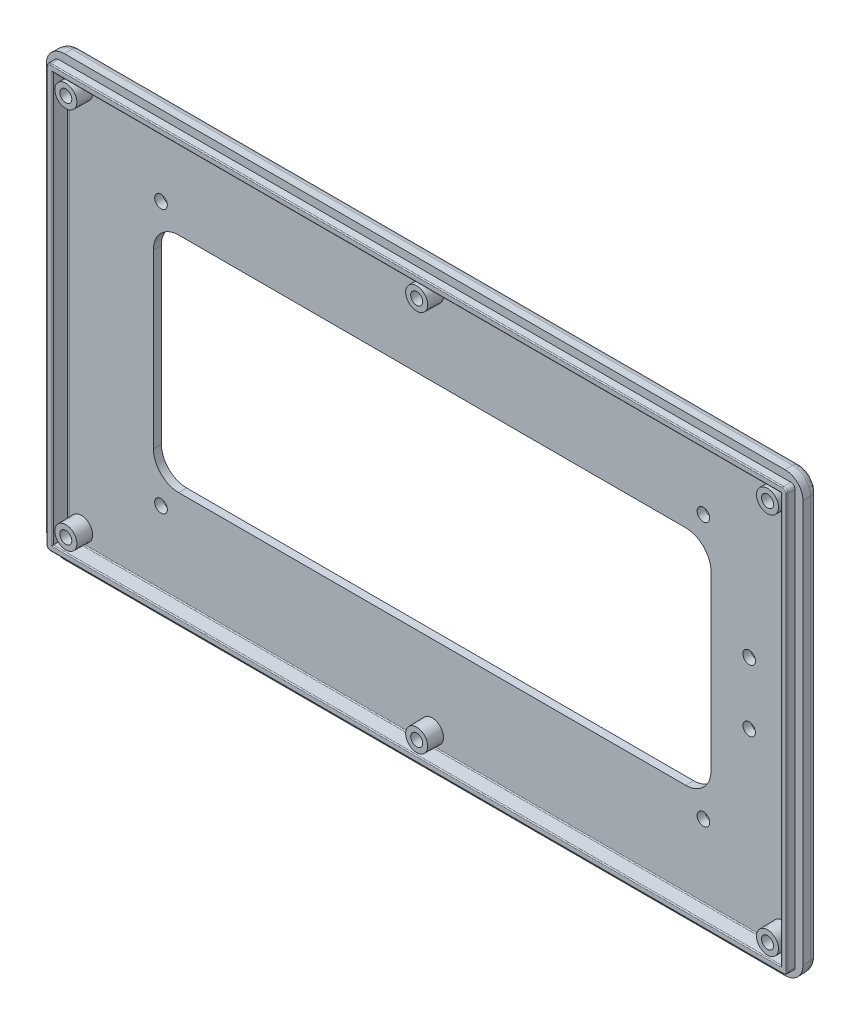
from build123d import *

# Parameters (mm, degrees)
SKETCH1_W                                      = 190
SKETCH1_H                                      = 110
BOSS_EXTRUDE1_DEPTH                            = 3.9
BOSS_EXTRUDE1_DRAFT                            = -1
SKETCH2_W                                      = 186
SKETCH2_H                                      = 106
BOSS_EXTRUDE2_DEPTH                            = 2
BOSS_EXTRUDE2_TAPER                            = 1
SKETCH3_W                                      = 182.86982026
SKETCH3_H                                      = 102.86982026
CUT_EXTRUDE1_DEPTH                             = 3.9
CUT_EXTRUDE1_DRAFT                             = -1
CSK_FOR_M2_5_FLAT_HEAD_MACHINE_SCREW1_AT_COUNT = 2
CSK_FOR_M2_5_FLAT_HEAD_MACHINE_SCREW1_AT_PITCH = 130.298158084
CSK_FOR_M2_5_FLAT_HEAD_MACHINE_SCREW_2_COUNT   = 2
CSK_FOR_M2_5_FLAT_HEAD_MACHINE_SCREW_2_PITCH   = 176.2
CSK_FOR_M2_5_FLAT_HEAD_MACHINE_SCREW_3_COUNT   = 2
CSK_FOR_M2_5_FLAT_HEAD_MACHINE_SCREW_3_PITCH   = 200.655027348
CSK_FOR_M2_5_FLAT_HEAD_MACHINE_SCREW_4_COUNT   = 2
CSK_FOR_M2_5_FLAT_HEAD_MACHINE_SCREW_4_PITCH   = 88.1
CSK_FOR_M2_5_FLAT_HEAD_MACHINE_SCREW_5_COUNT   = 2
CSK_FOR_M2_5_FLAT_HEAD_MACHINE_SCREW_5_PITCH   = 96
FILLET1_R                                      = 1
FILLET2_R                                      = 4.5
FILLET3_R                                      = 0.25
FILLET4_R                                      = 2
CUT_EXTRUDE2_REACH                             = 111.931
SKETCH12_R                                     = 1.5875
CUT_EXTRUDE3_REACH                             = 111.842
SKETCH14_R                                     = 1.575461152
SKETCH14_R_2                                   = 1.555513052


with BuildPart() as part:
    # Sketch1 → Boss-Extrude1 (with draft: the straight prism first)
    with BuildSketch(Plane.XY):
        Rectangle(SKETCH1_W, SKETCH1_H)
    extrude(amount=-BOSS_EXTRUDE1_DEPTH)
    # Boss-Extrude1: the draft: its side faces are tilted about the plane it starts from
    boss_extrude1_sides = [part.faces().sort_by_distance(p)[0] for p in [
        (0, -55, -1.95),
        (95, 0, -1.95),
        (0, 55, -1.95),
        (-95, 0, -1.95),
    ]]
    draft(boss_extrude1_sides, Plane.XY, BOSS_EXTRUDE1_DRAFT)

    # Sketch2 → Boss-Extrude2 (add)
    with BuildSketch(Plane.XY):
        Rectangle(SKETCH2_W, SKETCH2_H)
    extrude(amount=BOSS_EXTRUDE2_DEPTH, taper=BOSS_EXTRUDE2_TAPER)


with BuildPart() as cut_extrude1_tool:
    # Sketch3 → Cut-Extrude1 (with draft: the straight prism first)
    with BuildSketch(Plane.XY.offset(2)):
        Rectangle(SKETCH3_W, SKETCH3_H)
    extrude(amount=-CUT_EXTRUDE1_DEPTH)
    # Cut-Extrude1: the draft: its side faces are tilted about the plane it starts from
    cut_extrude1_sides = [cut_extrude1_tool.faces().sort_by_distance(p)[0] for p in [
        (-91.43491013, 0, 0.05),
        (0, -51.43491013, 0.05),
        (91.43491013, 0, 0.05),
        (0, 51.43491013, 0.05),
    ]]
    draft(cut_extrude1_sides, Plane.XY.offset(2), CUT_EXTRUDE1_DRAFT)


with BuildPart() as part_1:
    add(part.part)

    # Cut-Extrude1: cut by cut_extrude1_tool
    add(cut_extrude1_tool.part, mode=Mode.SUBTRACT)

    # Sketch4 → Revolve1 (revolve)
    with BuildSketch(Plane(origin=(0, -48, 0), x_dir=(1, 0, 0), z_dir=(0, 1, 0))):
        Polygon((-85.266835377, 1.9), (-88.1, 1.9), (-88.1, -2), (-85.33491013, -2), align=None)
    revolve(axis=Axis((-88.1, -48, -1.9), (0, 0, 1)))

    # Sketch5 → Revolve2 (revolve)
    with BuildSketch(Plane(origin=(0, 48, 0), x_dir=(1, 0, 0), z_dir=(0, 1, 0))):
        Polygon((2.833164623, 1.9), (0, 1.9), (0, -2), (2.76508987, -2), align=None)
    revolve(axis=Axis((0, 48, -1.9), (0, 0, 1)))

    # Sketch6 → Revolve3 (revolve)
    with BuildSketch(Plane(origin=(0, -48, 0), x_dir=(1, 0, 0), z_dir=(0, 1, 0))):
        Polygon((90.933164623, 1.9), (88.1, 1.9), (88.1, -2), (90.86508987, -2), align=None)
    revolve(axis=Axis((88.1, -48, -1.9), (0, 0, 1)))

    # Sketch7 → Revolve4 (revolve)
    with BuildSketch(Plane(origin=(0, 48, 0), x_dir=(1, 0, 0), z_dir=(0, 1, 0))):
        Polygon((90.933164623, 1.9), (88.1, 1.9), (88.1, -2), (90.86508987, -2), align=None)
    revolve(axis=Axis((88.1, 48, -1.9), (0, 0, 1)))

    # Sketch8 → Revolve5 (revolve)
    with BuildSketch(Plane(origin=(0, -48, 0), x_dir=(1, 0, 0), z_dir=(0, 1, 0))):
        Polygon((2.833164623, 1.9), (0, 1.9), (0, -2), (2.76508987, -2), align=None)
    revolve(axis=Axis((0, -48, -1.9), (0, 0, 1)))

    # Sketch9 → Revolve6 (revolve)
    with BuildSketch(Plane(origin=(0, 48, 0), x_dir=(1, 0, 0), z_dir=(0, 1, 0))):
        Polygon((-85.266835377, 1.9), (-88.1, 1.9), (-88.1, -2), (-85.33491013, -2), align=None)
    revolve(axis=Axis((-88.1, 48, -1.9), (0, 0, 1)))

    # Sketch10 → CSK for M2.5 Flat Head Machine Screw1 (revolve, cut)
    with BuildSketch(Plane(origin=(-88.1, 48, -3.9), x_dir=(0, 1, 0), z_dir=(1, 0, 0))):
        Polygon((0, 0), (0, 5.9), (1.5, 5.9), (1.5, 1.8), (2.8, 0.5), (2.8, 0), align=None)
    csk_for_m2_5_flat_head_machine_screw1 = revolve(axis=Axis((-88.1, 48, -10.25), (0, 0, 1)), mode=Mode.SUBTRACT)

    # CSK for M2.5 Flat Head Machine Screw1 at: CSK for M2.5 Flat Head Machine Screw1 ×2
    with Locations(*[Vector(0.6761415609836912, -0.7367717350106052, 0) * (i * CSK_FOR_M2_5_FLAT_HEAD_MACHINE_SCREW1_AT_PITCH) for i in range(1, CSK_FOR_M2_5_FLAT_HEAD_MACHINE_SCREW1_AT_COUNT)]):
        add(csk_for_m2_5_flat_head_machine_screw1, mode=Mode.SUBTRACT)

    # CSK for M2.5 Flat Head Machine Screw 2: CSK for M2.5 Flat Head Machine Screw1 ×2
    with Locations(*[(i * CSK_FOR_M2_5_FLAT_HEAD_MACHINE_SCREW_2_PITCH, 0, 0) for i in range(1, CSK_FOR_M2_5_FLAT_HEAD_MACHINE_SCREW_2_COUNT)]):
        add(csk_for_m2_5_flat_head_machine_screw1, mode=Mode.SUBTRACT)

    # CSK for M2.5 Flat Head Machine Screw 3: CSK for M2.5 Flat Head Machine Screw1 ×2
    with Locations(*[Vector(0.8781240237478384, -0.4784330662871306, 0) * (i * CSK_FOR_M2_5_FLAT_HEAD_MACHINE_SCREW_3_PITCH) for i in range(1, CSK_FOR_M2_5_FLAT_HEAD_MACHINE_SCREW_3_COUNT)]):
        add(csk_for_m2_5_flat_head_machine_screw1, mode=Mode.SUBTRACT)

    # CSK for M2.5 Flat Head Machine Screw 4: CSK for M2.5 Flat Head Machine Screw1 ×2
    with Locations(*[(i * CSK_FOR_M2_5_FLAT_HEAD_MACHINE_SCREW_4_PITCH, 0, 0) for i in range(1, CSK_FOR_M2_5_FLAT_HEAD_MACHINE_SCREW_4_COUNT)]):
        add(csk_for_m2_5_flat_head_machine_screw1, mode=Mode.SUBTRACT)

    # CSK for M2.5 Flat Head Machine Screw 5: CSK for M2.5 Flat Head Machine Screw1 ×2
    with Locations(*[(0, -i * CSK_FOR_M2_5_FLAT_HEAD_MACHINE_SCREW_5_PITCH, 0) for i in range(1, CSK_FOR_M2_5_FLAT_HEAD_MACHINE_SCREW_5_COUNT)]):
        add(csk_for_m2_5_flat_head_machine_screw1, mode=Mode.SUBTRACT)

    # Fillet1
    fillet1_edges = [part_1.edges().sort_by_distance(p)[0] for p in [
        (92.982544935, 52.982544935, 1),
        (-92.982544935, 52.982544935, 1),
        (-92.982544473, -52.982544473, 1.000026465),
        (92.982544473, -52.982544473, 1.000026465),
    ]]
    fillet(fillet1_edges, radius=FILLET1_R)

    # Fillet2
    fillet2_edges = [part_1.edges().sort_by_distance(p)[0] for p in [
        (94.965962623, 54.965962623, -1.95),
        (94.965962623, -54.965962623, -1.95),
        (-94.965962623, 54.965962623, -1.95),
        (-94.965962623, -54.965962623, -1.95),
    ]]
    fillet(fillet2_edges, radius=FILLET2_R)

    # Fillet3
    fillet3_edges = [part_1.edges().sort_by_distance(p)[0] for p in [
        (92.672259731, 52.672259731, 2),
        (0, 52.96508987, 2),
        (92.96508987, 0, 2),
        (-92.672259731, 52.672259731, 2),
        (92.672259731, -52.672259731, 2),
        (-92.96508987, 0, 2),
        (0, -52.96508987, 2),
        (-92.672259731, -52.672259731, 2),
        (-91.43491013, 0, 2),
        (0, -51.43491013, 2),
        (0, 51.43491013, 2),
        (91.43491013, 0, 2),
        (0, 51.366835377, -1.9),
        (-91.366835377, 0, -1.9),
        (91.366835377, 0, -1.9),
        (0, -51.366835377, -1.9),
    ]]
    fillet(fillet3_edges, radius=FILLET3_R)

    # Fillet4
    fillet4_edges = [part_1.edges().sort_by_distance(p)[0] for p in [
        (0, 54.931925247, -3.9),
        (93.614189622, 53.614189622, -3.9),
        (-93.614189622, 53.614189622, -3.9),
        (94.931925247, 0, -3.9),
        (-94.931925247, 0, -3.9),
        (93.614189622, -53.614189622, -3.9),
        (-93.614189622, -53.614189622, -3.9),
        (0, -54.931925247, -3.9),
    ]]
    fillet(fillet4_edges, radius=FILLET4_R)

    # Sketch12 → Cut-Extrude2 (cut, up to next)
    with BuildSketch(Plane(origin=(0, 0, -3.9), x_dir=(-1, 0, 0), z_dir=(0, 0, -1)), mode=Mode.PRIVATE) as cut_extrude2_sk1:
        with Locations((-68.1, 33.1)):
            Circle(SKETCH12_R)
    cut_extrude2_tool1 = extrude(cut_extrude2_sk1.sketch, amount=-CUT_EXTRUDE2_REACH, mode=Mode.PRIVATE) & part_1.part
    # Sketch12 → Cut-Extrude2 (cut, up to next)
    with BuildSketch(Plane(origin=(0, 0, -3.9), x_dir=(-1, 0, 0), z_dir=(0, 0, -1)), mode=Mode.PRIVATE) as cut_extrude2_sk2:
        with Locations((68.1, 33.1)):
            Circle(SKETCH12_R)
    cut_extrude2_tool2 = extrude(cut_extrude2_sk2.sketch, amount=-CUT_EXTRUDE2_REACH, mode=Mode.PRIVATE) & part_1.part
    # Sketch12 → Cut-Extrude2 (cut, up to next)
    with BuildSketch(Plane(origin=(0, 0, -3.9), x_dir=(-1, 0, 0), z_dir=(0, 0, -1)), mode=Mode.PRIVATE) as cut_extrude2_sk3:
        with Locations((68.1, -33.1)):
            Circle(SKETCH12_R)
    cut_extrude2_tool3 = extrude(cut_extrude2_sk3.sketch, amount=-CUT_EXTRUDE2_REACH, mode=Mode.PRIVATE) & part_1.part
    # Sketch12 → Cut-Extrude2 (cut, up to next)
    with BuildSketch(Plane(origin=(0, 0, -3.9), x_dir=(-1, 0, 0), z_dir=(0, 0, -1)), mode=Mode.PRIVATE) as cut_extrude2_sk4:
        with Locations((-68.1, -33.1)):
            Circle(SKETCH12_R)
    cut_extrude2_tool4 = extrude(cut_extrude2_sk4.sketch, amount=-CUT_EXTRUDE2_REACH, mode=Mode.PRIVATE) & part_1.part
    # Sketch12 → Cut-Extrude2 (cut, up to next)
    with BuildSketch(Plane(origin=(0, 0, -3.9), x_dir=(-1, 0, 0), z_dir=(0, 0, -1)), mode=Mode.PRIVATE) as cut_extrude2_sk5:
        with BuildLine():
            Line((-63.65, -28), (63.65, -28))
            ThreePointArc((63.65, -28), (68.140128061, -26.140128061), (70, -21.65))
            Line((70, -21.65), (70, 21.65))
            ThreePointArc((70, 21.65), (68.140128061, 26.140128061), (63.65, 28))
            Line((63.65, 28), (-63.65, 28))
            ThreePointArc((-63.65, 28), (-68.140128061, 26.140128061), (-70, 21.65))
            Line((-70, 21.65), (-70, -21.65))
            ThreePointArc((-70, -21.65), (-68.140128061, -26.140128061), (-63.65, -28))
        make_face()
    cut_extrude2_tool5 = extrude(cut_extrude2_sk5.sketch, amount=-CUT_EXTRUDE2_REACH, mode=Mode.PRIVATE) & part_1.part
    add(cut_extrude2_tool1.solids().sort_by_distance((68.1, 33.1, -3.9))[0], mode=Mode.SUBTRACT)
    add(cut_extrude2_tool2.solids().sort_by_distance((-68.1, 33.1, -3.9))[0], mode=Mode.SUBTRACT)
    add(cut_extrude2_tool3.solids().sort_by_distance((-68.1, -33.1, -3.9))[0], mode=Mode.SUBTRACT)
    add(cut_extrude2_tool4.solids().sort_by_distance((68.1, -33.1, -3.9))[0], mode=Mode.SUBTRACT)
    add(cut_extrude2_tool5.solids().sort_by_distance((0, 0, -3.9))[0], mode=Mode.SUBTRACT)

    # Sketch14 → Cut-Extrude3 (cut, up to next)
    with BuildSketch(Plane.XY.offset(-1.9), mode=Mode.PRIVATE) as cut_extrude3_sk1:
        with Locations((79.601471829, 7.789433975)):
            Circle(SKETCH14_R)
    cut_extrude3_tool1 = extrude(cut_extrude3_sk1.sketch, amount=-CUT_EXTRUDE3_REACH, mode=Mode.PRIVATE) & part_1.part
    # Sketch14 → Cut-Extrude3 (cut, up to next)
    with BuildSketch(Plane.XY.offset(-1.9), mode=Mode.PRIVATE) as cut_extrude3_sk2:
        with Locations((79.601471829, -7.768066025)):
            Circle(SKETCH14_R_2)
    cut_extrude3_tool2 = extrude(cut_extrude3_sk2.sketch, amount=-CUT_EXTRUDE3_REACH, mode=Mode.PRIVATE) & part_1.part
    add(cut_extrude3_tool1.solids().sort_by_distance((79.601472, 7.789434, -1.9))[0], mode=Mode.SUBTRACT)
    add(cut_extrude3_tool2.solids().sort_by_distance((79.601472, -7.768066, -1.9))[0], mode=Mode.SUBTRACT)


solid = part_1.part
